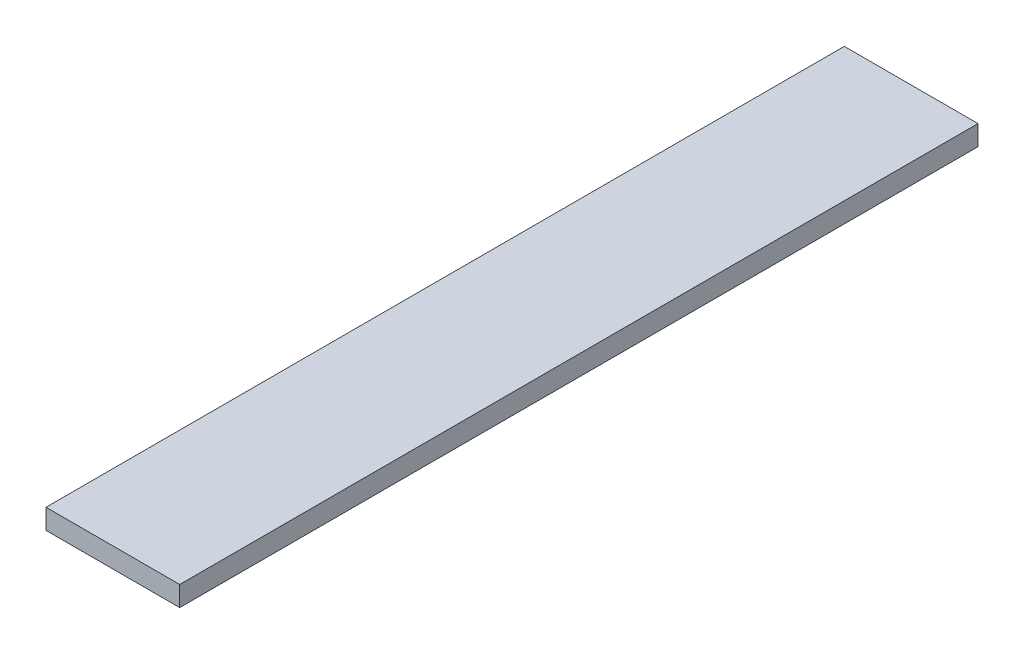
from build123d import *

# Parameters (mm, degrees)
SKETCH1_W           = 127
SKETCH1_H           = 758.19
BOSS_EXTRUDE1_DEPTH = 19.05


with BuildPart() as part:
    # Sketch1 → Boss-Extrude1 (new body)
    with BuildSketch(Plane(origin=(0, 0, 0), x_dir=(1, 0, 0), z_dir=(0, 1, 0))):
        with Locations((63.5, -379.095)):
            Rectangle(SKETCH1_W, SKETCH1_H)
    extrude(amount=BOSS_EXTRUDE1_DEPTH)


solid = part.part
